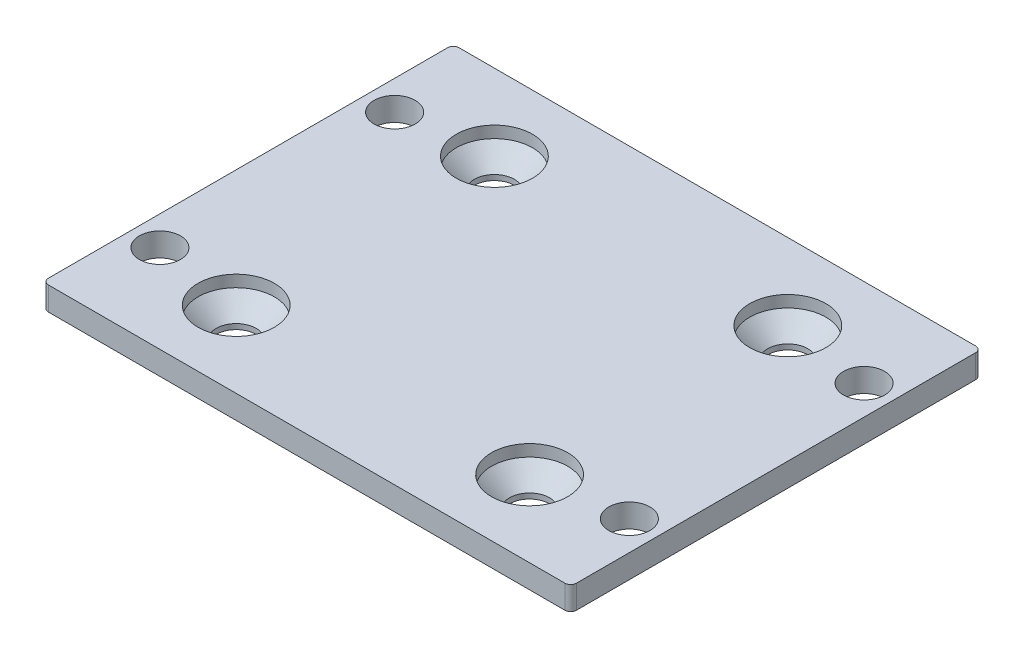
from build123d import *

# Parameters (mm, degrees)
ESQUISSE1_W                              = 45
ESQUISSE1_H                              = 35
BOSS_EXTRU_1_DEPTH                       = 2
ESQUISSE2_W                              = 35
ESQUISSE2_H                              = 32
BOSS_EXTRU_2_DEPTH                       = 1
CONG_1_R                                 = 5
CONG_2_R                                 = 0.5
CHANFREIN1_SIZE                          = 0.5
ESQUISSE3_R                              = 1.75
ENL_V_MAT_EXTRU_1_DEPTH                  = 29.574464124
DIAM_TRE_DU_PER_AGE_6_5_6_5_1_D          = 6.5
DIAM_TRE_DU_PER_AGE_6_5_6_5_1_DEPTH      = 1
FRAISAGE_POUR_VIS_T_TE_FRAIS_E_6_2_COUNT = 2
FRAISAGE_POUR_VIS_T_TE_FRAIS_E_6_2_PITCH = 33.301651611
FRAISAGE_POUR_VIS_T_TE_FRAIS_E_6_3_COUNT = 2
FRAISAGE_POUR_VIS_T_TE_FRAIS_E_6_3_PITCH = 22
FRAISAGE_POUR_VIS_T_TE_FRAIS_E_6_4_COUNT = 2
FRAISAGE_POUR_VIS_T_TE_FRAIS_E_6_4_PITCH = 25


with BuildPart() as part:
    # Esquisse1 → Boss.-Extru.1 (new body)
    with BuildSketch(Plane(origin=(0, 0, 0), x_dir=(1, 0, 0), z_dir=(0, 1, 0))):
        Rectangle(ESQUISSE1_W, ESQUISSE1_H)
    extrude(amount=BOSS_EXTRU_1_DEPTH)

    # Esquisse2 → Boss.-Extru.2 (add)
    with BuildSketch(Plane.XZ):
        Rectangle(ESQUISSE2_W, ESQUISSE2_H)
    extrude(amount=BOSS_EXTRU_2_DEPTH)

    # Congé1
    cong_1_edges = [part.edges().sort_by_distance(p)[0] for p in [
        (17.5, -0.5, 16),
        (-17.5, -0.5, -16),
        (17.5, -0.5, -16),
        (-17.5, -0.5, 16),
    ]]
    fillet(cong_1_edges, radius=CONG_1_R)

    # Congé2
    cong_2_edges = [part.edges().sort_by_distance(p)[0] for p in [
        (22.5, 1, -17.5),
        (-22.5, 1, -17.5),
        (22.5, 1, 17.5),
        (-22.5, 1, 17.5),
    ]]
    fillet(cong_2_edges, radius=CONG_2_R)

    # Chanfrein1
    chanfrein1_edges = [part.edges().sort_by_distance(p)[0] for p in [
        (17.5, -1, 0),
        (16.035533906, -1, 14.535533906),
        (16.035533906, -1, -14.535533906),
        (0, -1, 16),
        (0, -1, -16),
        (-16.035533906, -1, 14.535533906),
        (-16.035533906, -1, -14.535533906),
        (-17.5, -1, 0),
    ]]
    chamfer(chanfrein1_edges, length=CHANFREIN1_SIZE)

    # Esquisse3 → Enlèv. mat.-Extru.1 (cut, through all)
    with BuildSketch(Plane.XZ):
        with Locations((-20, 10)):
            Circle(ESQUISSE3_R)
        with Locations((20, 10)):
            Circle(ESQUISSE3_R)
        with Locations((20, -10)):
            Circle(ESQUISSE3_R)
        with Locations((-20, -10)):
            Circle(ESQUISSE3_R)
    extrude(amount=-ENL_V_MAT_EXTRU_1_DEPTH, mode=Mode.SUBTRACT)

    # Diamètre du perçage Ø6.5 (6.5)1
    with Locations(Plane(origin=(0, 2, 0), x_dir=(1, 0, 0), z_dir=(0, 1, 0))):
        with Locations((-12.5, -11), (12.5, 11), (-12.5, 11), (12.5, -11)):
            Hole(DIAM_TRE_DU_PER_AGE_6_5_6_5_1_D / 2, depth=DIAM_TRE_DU_PER_AGE_6_5_6_5_1_DEPTH)

    # Esquisse4 → Fraisage pour vis à tête fraisée à 6 pans creux M31 (revolve, cut)
    with BuildSketch(Plane(origin=(-12.5, 1, -11), x_dir=(0, 0, 1), z_dir=(1, 0, 0))):
        Polygon((0, 0), (0, 2), (1.7, 2), (1.7, 1.55), (3.25, 0), align=None)
    fraisage_pour_vis_t_te_frais_e_6_pan = revolve(axis=Axis((-12.5, 7.35, -11), (0, -1, 0)), mode=Mode.SUBTRACT)

    # Fraisage pour vis _ t_te frais_e _ 6 2: Fraisage pour vis à tête fraisée à 6 pans creux M31 ×2
    with Locations(*[Vector(0.7507135169227553, 0, 0.6606278948920248) * (i * FRAISAGE_POUR_VIS_T_TE_FRAIS_E_6_2_PITCH) for i in range(1, FRAISAGE_POUR_VIS_T_TE_FRAIS_E_6_2_COUNT)]):
        add(fraisage_pour_vis_t_te_frais_e_6_pan, mode=Mode.SUBTRACT)

    # Fraisage pour vis _ t_te frais_e _ 6 3: Fraisage pour vis à tête fraisée à 6 pans creux M31 ×2
    with Locations(*[(0, 0, i * FRAISAGE_POUR_VIS_T_TE_FRAIS_E_6_3_PITCH) for i in range(1, FRAISAGE_POUR_VIS_T_TE_FRAIS_E_6_3_COUNT)]):
        add(fraisage_pour_vis_t_te_frais_e_6_pan, mode=Mode.SUBTRACT)

    # Fraisage pour vis _ t_te frais_e _ 6 4: Fraisage pour vis à tête fraisée à 6 pans creux M31 ×2
    with Locations(*[(i * FRAISAGE_POUR_VIS_T_TE_FRAIS_E_6_4_PITCH, 0, 0) for i in range(1, FRAISAGE_POUR_VIS_T_TE_FRAIS_E_6_4_COUNT)]):
        add(fraisage_pour_vis_t_te_frais_e_6_pan, mode=Mode.SUBTRACT)


solid = part.part
